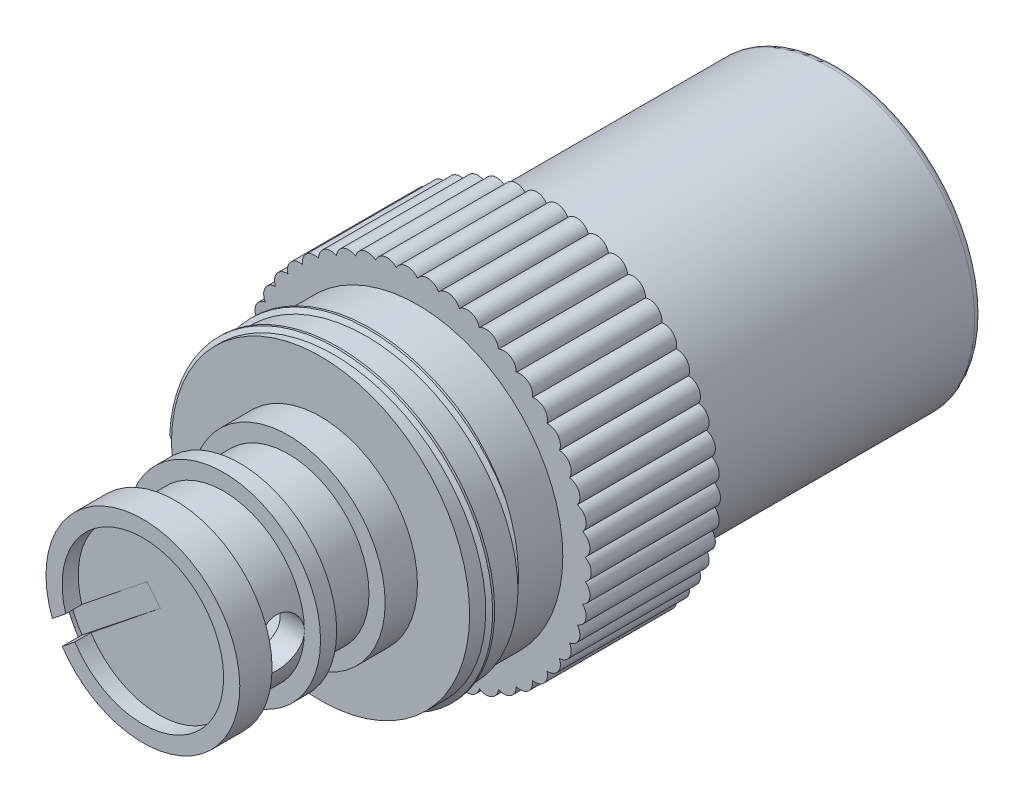
from build123d import *

# Parameters (mm, degrees)
SKETCH18_R              = 4.5
BOSS_EXTRUDE3_DEPTH     = 9
SKETCH19_R              = 5
BOSS_EXTRUDE4_DEPTH     = 4
BOSS_EXTRUDE5_DEPTH     = 4
CIRPATTERN3_COUNT       = 50
SKETCH21_R              = 4.5
BOSS_EXTRUDE7_DEPTH     = 3
SKETCH24_R              = 4.6147
BOSS_EXTRUDE9_DEPTH     = 1.5
THREAD4_PITCH           = 1
THREAD4_TO              = 1.5
SKETCH29_R              = 3
BOSS_EXTRUDE10_DEPTH    = 1
SKETCH30_R              = 2.5
BOSS_EXTRUDE11_DEPTH    = 1.5
SKETCH31_R              = 3
BOSS_EXTRUDE12_DEPTH    = 0.5
SKETCH32_R              = 2.5
BOSS_EXTRUDE13_DEPTH    = 1.5
SKETCH33_R              = 3
BOSS_EXTRUDE14_DEPTH    = 1
CUT_EXTRUDE1_DEPTH      = 23.80422626
CUT_EXTRUDE1_DEPTH_BACK = 23.80422626
SKETCH34_R              = 0.75
CUT_EXTRUDE2_START      = -0.498090887
SKETCH35_R              = 2.5
CUT_EXTRUDE2_DEPTH      = 0.498090887
CUT_EXTRUDE3_DEPTH      = 0.5
CUT_REVOLVE2_ANGLE      = 2
SKETCH40_R              = 4
CUT_EXTRUDE4_DEPTH      = 11
FILLET2_R               = 0.25
SKETCH41_R              = 2.75
CUT_EXTRUDE5_DEPTH      = 3.5
SKETCH42_R              = 1.75
CUT_EXTRUDE6_DEPTH      = 5.75


with BuildPart() as part:
    # Sketch18 → Boss-Extrude3 (new body)
    with BuildSketch(Plane.XY):
        Circle(SKETCH18_R)
    extrude(amount=BOSS_EXTRUDE3_DEPTH)

    # Sketch19 → Boss-Extrude4 (add)
    with BuildSketch(Plane.XY.offset(9)):
        Circle(SKETCH19_R)
    extrude(amount=BOSS_EXTRUDE4_DEPTH)

    # Sketch20 → Boss-Extrude5 (add)
    with BuildSketch(Plane(origin=(0, 0, 9), x_dir=(-1, 0, 0), z_dir=(0, 0, -1))):
        with BuildLine():
            ThreePointArc((-4.98556, -0.379725541), (-5, 0), (-4.98556, 0.379725541))
            ThreePointArc((-4.98556, 0.379725541), (-5.38, 0), (-4.98556, -0.379725541))
        make_face()
    boss_extrude5 = extrude(amount=-BOSS_EXTRUDE5_DEPTH)

    # CirPattern3: Boss-Extrude5 ×50 about axis
    cirpattern3_axis = Axis((0, 0, 0), (0, 0, 1))
    for i in range(1, CIRPATTERN3_COUNT):
        add(boss_extrude5.rotate(cirpattern3_axis, i * 360 / CIRPATTERN3_COUNT))

    # Sketch21 → Boss-Extrude7 (add)
    with BuildSketch(Plane.XY.offset(13)):
        Circle(SKETCH21_R)
    extrude(amount=BOSS_EXTRUDE7_DEPTH)

    # Sketch24 → Boss-Extrude9 (add)
    with BuildSketch(Plane.XY.offset(16)):
        Circle(SKETCH24_R)
    extrude(amount=-BOSS_EXTRUDE9_DEPTH)

    # Thread4: arcs per turn and ends read off the stored shape
    # Thread4: the profile of Thread Profile8 profile screwed along a right-hand helix through 1.75 turns, 8 arcs to a turn; built about Z, then put on its axis
    thread4_z = Axis((0, 0, 0), (0, 0, 1))
    thread4_corners = [(4.6144, 2e-09, -0.000173205), (4.6144, 2e-09, 0.218923204), (4.750016469, 2e-09, 0.140625), (4.750016469, 2e-09, 0.078125)]
    with BuildLine(mode=Mode.PRIVATE) as thread4_profile:
        Line(thread4_corners[0], thread4_corners[1])
        Line(thread4_corners[1], thread4_corners[2])
        Line(thread4_corners[2], thread4_corners[3])
        Line(thread4_corners[3], thread4_corners[0])
    thread4_cap = Face(thread4_profile.wire())
    thread4_turn_angles = [0, 22.5, 45, 67.5, 90, 112.5, 135, 157.5, 180, 202.5, 225, 247.5, 270, 292.5, 315, 337.5, 360]
    thread4_turn_weights = [1, 0.9238795325112867, 1, 0.9238795325112867, 1, 0.9238795325112867, 1, 0.9238795325112867, 1, 0.9238795325112867, 1, 0.9238795325112867, 1, 0.9238795325112867, 1, 0.9238795325112867, 1]
    thread4_turn_rails = [Edge.make_bspline([Vector(p[0], p[1], 0).rotate(thread4_z, thread4_turn_angles[k]) / thread4_turn_weights[k] + Vector(0, 0, p[2] + THREAD4_PITCH * thread4_turn_angles[k] / 360) for k in range(17)], [0, 0, 0, 1, 1, 2, 2, 3, 3, 4, 4, 5, 5, 6, 6, 7, 7, 8, 8, 8], 2, thread4_turn_weights) for p in thread4_corners]
    thread4_turn_sides = [Face.make_surface_from_curves(thread4_turn_rails[p[0]], thread4_turn_rails[p[1]]) for p in [(0, 1), (1, 2), (2, 3), (3, 0)]]
    thread4_last_angles = [360, 382.5, 405, 427.5, 450, 472.5, 495, 517.5, 540, 562.5, 585, 607.5, 630]
    thread4_last_weights = [1, 0.9238795325112867, 1, 0.9238795325112867, 1, 0.9238795325112867, 1, 0.9238795325112867, 1, 0.9238795325112867, 1, 0.9238795325112867, 1]
    thread4_last_rails = [Edge.make_bspline([Vector(p[0], p[1], 0).rotate(thread4_z, thread4_last_angles[k]) / thread4_last_weights[k] + Vector(0, 0, p[2] + THREAD4_PITCH * thread4_last_angles[k] / 360) for k in range(13)], [0, 0, 0, 1, 1, 2, 2, 3, 3, 4, 4, 5, 5, 6, 6, 6], 2, thread4_last_weights) for p in thread4_corners]
    thread4_last_sides = [Face.make_surface_from_curves(thread4_last_rails[p[0]], thread4_last_rails[p[1]]) for p in [(0, 1), (1, 2), (2, 3), (3, 0)]]
    thread4 = Plane(origin=(0, 0, 16), x_dir=(-0.999847695, 0.017452406, 0), z_dir=(0, 0, -1)) * split(Solid(Shell([*thread4_turn_sides, *thread4_last_sides, thread4_cap, thread4_cap.rotate(thread4_z, 630).moved(Location((0, 0, THREAD4_PITCH * 630 / 360)))])), bisect_by=Plane.XY.offset(THREAD4_TO), keep=Keep.BOTTOM, mode=Mode.PRIVATE)
    add(thread4)

    # Sketch29 → Boss-Extrude10 (add)
    with BuildSketch(Plane.XY.offset(16)):
        Circle(SKETCH29_R)
    extrude(amount=BOSS_EXTRUDE10_DEPTH)

    # Sketch30 → Boss-Extrude11 (add)
    with BuildSketch(Plane.XY.offset(17)):
        Circle(SKETCH30_R)
    extrude(amount=BOSS_EXTRUDE11_DEPTH)

    # Sketch31 → Boss-Extrude12 (add)
    with BuildSketch(Plane.XY.offset(18.5)):
        Circle(SKETCH31_R)
    extrude(amount=BOSS_EXTRUDE12_DEPTH)

    # Sketch32 → Boss-Extrude13 (add)
    with BuildSketch(Plane.XY.offset(19)):
        Circle(SKETCH32_R)
    extrude(amount=BOSS_EXTRUDE13_DEPTH)

    # Sketch33 → Boss-Extrude14 (add)
    with BuildSketch(Plane.XY.offset(20.5)):
        Circle(SKETCH33_R)
    extrude(amount=BOSS_EXTRUDE14_DEPTH)

    # Sketch34 → Cut-Extrude1 (cut, two sides: drawn at the far end of the back side and taken through both)
    with BuildSketch(Plane(origin=(0, 0, 0), x_dir=(0, 0, -1), z_dir=(1, 0, 0)).offset(-CUT_EXTRUDE1_DEPTH_BACK)):
        with Locations((-19.75, 0)):
            Circle(SKETCH34_R)
    extrude(amount=CUT_EXTRUDE1_DEPTH + CUT_EXTRUDE1_DEPTH_BACK, mode=Mode.SUBTRACT)

    # Sketch35 → Cut-Extrude2 (cut)
    with BuildSketch(Plane.XY.offset(21.5).offset(CUT_EXTRUDE2_START)):
        Circle(SKETCH35_R)
    extrude(amount=CUT_EXTRUDE2_DEPTH, mode=Mode.SUBTRACT)

    # Sketch36 → Cut-Extrude3 (cut)
    with BuildSketch(Plane.XY.offset(21.001909113)):
        Polygon((-1.756416383, -1.065746094), (-2.790482736, -1.89692601), (-3.200614834, -1.386682927), (-2.166548482, -0.555503011), align=None)
    extrude(amount=CUT_EXTRUDE3_DEPTH, mode=Mode.SUBTRACT)

    # Sketch37 → Cut-Revolve2 (revolve, cut)
    with BuildSketch(Plane.XY.offset(21.001909113)):
        with BuildLine():
            Line((-2.389582157, -0.734776914), (-0.368154983, 0.890041131))
            Line((-0.368154983, 0.890041131), (0.041977116, 0.379798048))
            Line((0.041977116, 0.379798048), (-2.10616527, -1.346873363))
            Line((-2.10616527, -1.346873363), (-2.497780878, -1.661652998))
            ThreePointArc((-2.497780878, -1.661652998), (-2.667290762, -1.373156943), (-2.80361849, -1.06757827))
            Line((-2.80361849, -1.06757827), (-2.389582157, -0.734776914))
        make_face()
    revolve(axis=Axis((-0.368154983, 0.890041131, 21.001909113), (0.6264981557533815, -0.7794229024333399, 0)), revolution_arc=CUT_REVOLVE2_ANGLE, mode=Mode.SUBTRACT)

    # Sketch40 → Cut-Extrude4 (cut)
    with BuildSketch(Plane(origin=(0, 0, 0), x_dir=(-1, 0, 0), z_dir=(0, 0, -1))):
        Circle(SKETCH40_R)
    extrude(amount=-CUT_EXTRUDE4_DEPTH, mode=Mode.SUBTRACT)

    # Fillet2
    fillet2_edges = [part.edges().sort_by_distance(p)[0] for p in [
        (-4.5, 0, 0),
        (4, 0, 0),
    ]]
    fillet(fillet2_edges, radius=FILLET2_R - 0.0001)  # a hair under: the kernel refuses the full size

    # Sketch41 → Cut-Extrude5 (cut)
    with BuildSketch(Plane(origin=(0, 0, 11), x_dir=(-1, 0, 0), z_dir=(0, 0, -1))):
        Circle(SKETCH41_R)
    extrude(amount=-CUT_EXTRUDE5_DEPTH, mode=Mode.SUBTRACT)

    # Sketch42 → Cut-Extrude6 (cut)
    with BuildSketch(Plane(origin=(0, 0, 14.5), x_dir=(-1, 0, 0), z_dir=(0, 0, -1))):
        Circle(SKETCH42_R)
    extrude(amount=-CUT_EXTRUDE6_DEPTH, mode=Mode.SUBTRACT)


solid = part.part
